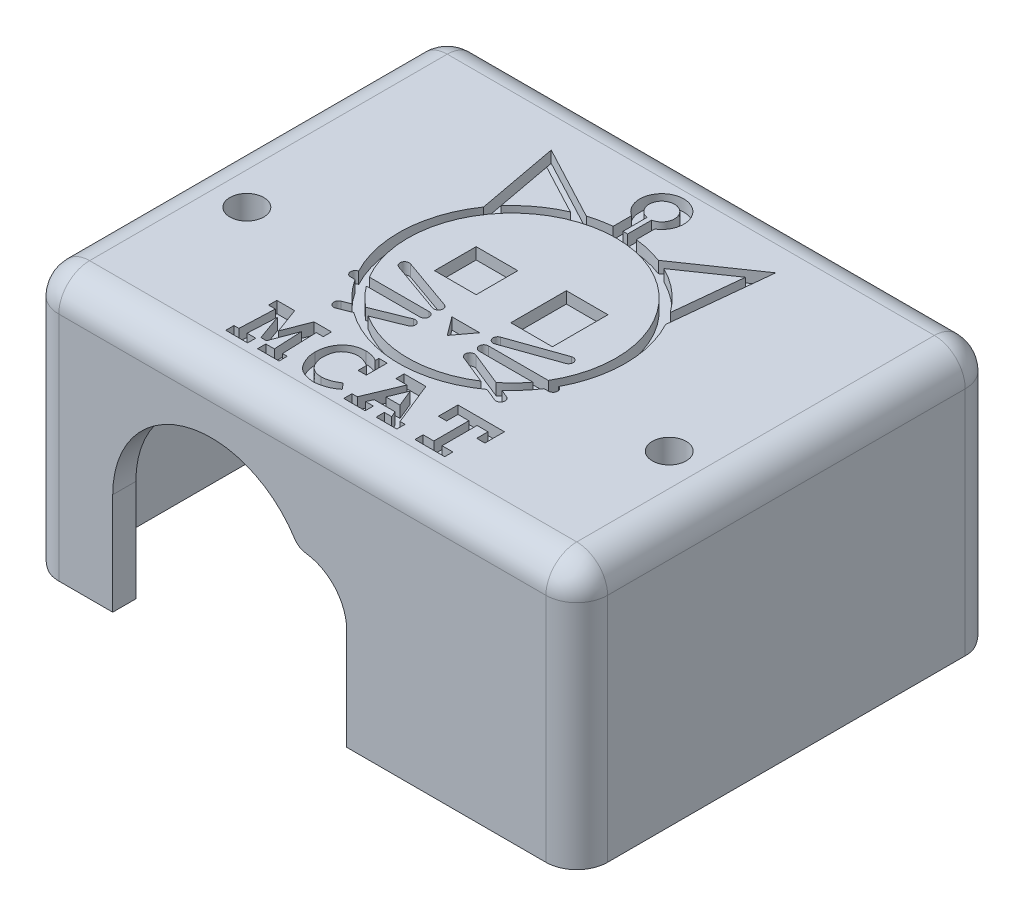
from build123d import *

# Parameters (mm, degrees)
SKETCH1_W           = 35.6
SKETCH1_H           = 27.2
BOSS_EXTRUDE1_DEPTH = 2
SKETCH3_W           = 35.6
SKETCH3_H           = 27.2
SKETCH3_W_2         = 32.6
SKETCH3_H_2         = 24.2
BOSS_EXTRUDE2_DEPTH = 15
CUT_EXTRUDE1_REACH  = 37.801
FILLET1_R           = 1
CUT_EXTRUDE2_REACH  = 42.955
SKETCH6_W           = 1.25
SKETCH6_H           = 8
FILLET2_R           = 1
CUT_EXTRUDE3_REACH  = 30.121
SKETCH7_R           = 1.1
FILLET4_R           = 2
FILLET5_R           = 1.5
SKETCH8_W           = 2.7
SKETCH8_H           = 3.6
SKETCH8_H_2         = 2.7
CUT_EXTRUDE4_DEPTH  = 0.75
CUT_EXTRUDE5_DEPTH  = 0.75


with BuildPart() as part:
    # Sketch1 → Boss-Extrude1 (new body)
    with BuildSketch(Plane(origin=(0, 0, 0), x_dir=(1, 0, 0), z_dir=(0, 1, 0))):
        Rectangle(SKETCH1_W, SKETCH1_H)
    extrude(amount=BOSS_EXTRUDE1_DEPTH)

    # Sketch3 → Boss-Extrude2 (add)
    with BuildSketch(Plane.XZ):
        Rectangle(SKETCH3_W, SKETCH3_H)
        Rectangle(SKETCH3_W_2, SKETCH3_H_2, mode=Mode.SUBTRACT)
    extrude(amount=BOSS_EXTRUDE2_DEPTH)

    # Sketch5 → Cut-Extrude1 (cut, up to next)
    with BuildSketch(Plane.XY.offset(13.6), mode=Mode.PRIVATE) as cut_extrude1_sk1:
        with BuildLine():
            Line((-12.3, -15), (-12.3, -8.4))
            ThreePointArc((-12.3, -8.4), (-7.44443562, -2.189145098), (-0.245400433, -5.402417018))
            ThreePointArc((-0.245400433, -5.402417018), (1.95331647, -6.236530414), (2.875, -8.4))
            Line((2.875, -8.4), (2.875, -15))
            Line((2.875, -15), (-12.3, -15))
        make_face()
    cut_extrude1_tool1 = extrude(cut_extrude1_sk1.sketch, amount=-CUT_EXTRUDE1_REACH, mode=Mode.PRIVATE) & part.part
    add(cut_extrude1_tool1.solids().sort_by_distance((-4.950325, -9.267969, 13.6))[0], mode=Mode.SUBTRACT)

    # Fillet1
    fillet1_edges = [part.edges().sort_by_distance(p)[0] for p in [
        (-0.245400433, -5.402417018, 12.85),
    ]]
    fillet(fillet1_edges, radius=FILLET1_R)

    # Sketch6 → Cut-Extrude2 (cut, up to next)
    with BuildSketch(Plane.ZY.offset(17.8), mode=Mode.PRIVATE) as cut_extrude2_sk1:
        with Locations((-7.975, -11)):
            Rectangle(SKETCH6_W, SKETCH6_H)
    cut_extrude2_tool1 = extrude(cut_extrude2_sk1.sketch, amount=-CUT_EXTRUDE2_REACH, mode=Mode.PRIVATE) & part.part
    add(cut_extrude2_tool1.solids().sort_by_distance((-17.8, -11, -7.975))[0], mode=Mode.SUBTRACT)

    # Fillet2
    fillet2_edges = [part.edges().sort_by_distance(p)[0] for p in [
        (16.3, -7.5, 12.1),
        (-16.3, -7.5, 12.1),
        (-16.3, -7.5, -12.1),
        (16.3, -7.5, -12.1),
    ]]
    fillet(fillet2_edges, radius=FILLET2_R)

    # Sketch7 → Cut-Extrude3 (cut, up to next)
    with BuildSketch(Plane(origin=(0, 2, 0), x_dir=(1, 0, 0), z_dir=(0, 1, 0)), mode=Mode.PRIVATE) as cut_extrude3_sk1:
        with Locations(Location((-13.7, -3.5, 0), (0, 0, 270))):
            Circle(SKETCH7_R)
    cut_extrude3_tool1 = extrude(cut_extrude3_sk1.sketch, amount=-CUT_EXTRUDE3_REACH, mode=Mode.PRIVATE) & part.part
    # Sketch7 → Cut-Extrude3 (cut, up to next)
    with BuildSketch(Plane(origin=(0, 2, 0), x_dir=(1, 0, 0), z_dir=(0, 1, 0)), mode=Mode.PRIVATE) as cut_extrude3_sk2:
        with Locations(Location((13.7, -3.5, 0), (0, 0, 270))):
            Circle(SKETCH7_R)
    cut_extrude3_tool2 = extrude(cut_extrude3_sk2.sketch, amount=-CUT_EXTRUDE3_REACH, mode=Mode.PRIVATE) & part.part
    add(cut_extrude3_tool1.solids().sort_by_distance((-13.7, 2, 3.5))[0], mode=Mode.SUBTRACT)
    add(cut_extrude3_tool2.solids().sort_by_distance((13.7, 2, 3.5))[0], mode=Mode.SUBTRACT)

    # Fillet4
    fillet4_edges = [part.edges().sort_by_distance(p)[0] for p in [
        (17.8, 2, 0),
        (0, 2, -13.6),
        (-17.8, 2, 0),
        (-17.8, -6.5, -13.6),
        (17.8, -6.5, -13.6),
        (17.8, -6.5, 13.6),
        (-17.8, -6.5, 13.6),
        (0, 2, 13.6),
    ]]
    fillet(fillet4_edges, radius=FILLET4_R)

    # Fillet5
    # the kernel refuses this fillet: 1.5 mm, written as the material it takes off along each edge
    with BuildSketch(Plane(origin=(-15.8, -15, -13.6), x_dir=(0, 0, 1), z_dir=(1, 0, 0))) as fillet5_piece_1:
        with BuildLine():
            CenterArc((FILLET5_R, -FILLET5_R), FILLET5_R, 90, 90)
            Line((0, -FILLET5_R), (0, 0))
            Line((0, 0), (FILLET5_R, 0))
        make_face()
    extrude(amount=35.35, mode=Mode.SUBTRACT)
    with BuildSketch(Plane(origin=(-17.8, -15, 15.35), x_dir=(0, 1, 0), z_dir=(0, 0, -1))) as fillet5_piece_2:
        with BuildLine():
            CenterArc((FILLET5_R, FILLET5_R), FILLET5_R, 180, 90)
            Line((0, FILLET5_R), (0, 0))
            Line((0, 0), (FILLET5_R, 0))
        make_face()
    extrude(amount=26.45, mode=Mode.SUBTRACT)
    with BuildSketch(Plane(origin=(-15.8, -15, -11.6), x_dir=(-1, 0, 0), z_dir=(0, 0, 1))) as fillet5_piece_3:
        with BuildLine():
            CenterArc((2 - FILLET5_R, -FILLET5_R), FILLET5_R, 0, 90)
            Line((2, -FILLET5_R), (2, 0))
            Line((2, 0), (2 - FILLET5_R, 0))
        make_face()
    revolve(axis=Axis((-15.8, -15, -11.6), (0, -1, 0)), revolution_arc=90, mode=Mode.SUBTRACT)
    with BuildSketch(Plane(origin=(-17.8, -15, -4.85), x_dir=(1, 0, 0), z_dir=(0, 0, -1))) as fillet5_piece_4:
        with BuildLine():
            CenterArc((FILLET5_R, -FILLET5_R), FILLET5_R, 90, 90)
            Line((0, -FILLET5_R), (0, 0))
            Line((0, 0), (FILLET5_R, 0))
        make_face()
    extrude(amount=6.75, mode=Mode.SUBTRACT)

    # Sketch8 → Cut-Extrude4 (cut)
    # profile 1 of 6: a face of its own
    with BuildSketch(Plane(origin=(0, 2, 0), x_dir=(1, 0, 0), z_dir=(0, 1, 0))):
        with BuildLine():
            Line((-0.75, 8.505629006), (-0.75, 7.336211556))
            Line((-0.75, 7.336211556), (-0.75, 7.311634564))
            ThreePointArc((-0.75, 7.311634564), (-1.48029755, 7.199390194), (-2.195635708, 7.014391195))
            Line((-2.195635708, 7.014391195), (-7.042682679, 9.587218689))
            Line((-7.042682679, 9.587218689), (-6.036927128, 4.192613845))
            ThreePointArc((-6.036927128, 4.192613845), (-7.337364656, 0.430789867), (-6.4860712, -3.457366105))
            ThreePointArc((-6.4860712, -3.457366105), (-6.718152787, -3.783240273), (-6.42, -4.05))
            Line((-6.42, -4.05), (-6.13351449, -4.05))
            ThreePointArc((-6.13351449, -4.05), (-5.54466624, -4.824849872), (-4.858607658, -5.515109393))
            Line((-4.858607658, -5.515109393), (-5.369789319, -5.721892557))
            ThreePointArc((-5.369789319, -5.721892557), (-5.535396762, -6.1125), (-5.144789319, -6.278107443))
            Line((-5.144789319, -6.278107443), (-4.321743388, -5.945168971))
            ThreePointArc((-4.321743388, -5.945168971), (0, -7.35), (4.321743388, -5.945168971))
            Line((4.321743388, -5.945168971), (5.144789319, -6.278107443))
            ThreePointArc((5.144789319, -6.278107443), (5.535396762, -6.1125), (5.369789319, -5.721892557))
            Line((5.369789319, -5.721892557), (4.858607658, -5.515109393))
            ThreePointArc((4.858607658, -5.515109393), (5.54466624, -4.824849872), (6.13351449, -4.05))
            Line((6.13351449, -4.05), (6.42, -4.05))
            ThreePointArc((6.42, -4.05), (6.718152787, -3.783240273), (6.4860712, -3.457366105))
            ThreePointArc((6.4860712, -3.457366105), (7.349970345, 0.020878865), (6.466324186, 3.49415963))
            Line((6.466324186, 3.49415963), (7.136935048, 9.970524713))
            Line((7.136935048, 9.970524713), (2.626797664, 6.864578212))
            ThreePointArc((2.626797664, 6.864578212), (1.703131076, 7.149954163), (0.75, 7.311634564))
            Line((0.75, 7.311634564), (0.75, 7.336211556))
            Line((0.75, 7.336211556), (0.75, 8.505629006))
            ThreePointArc((0.75, 8.505629006), (0, 11.142291088), (-0.75, 8.505629006))
        make_face()
        with BuildLine():
            Line((1.92, -4.05), (5.4, -4.05))
            ThreePointArc((5.4, -4.05), (4.852637538, -4.691951505), (4.229474624, -5.26061255))
            Line((4.229474624, -5.26061255), (2.0325, -4.371892557))
            ThreePointArc((2.0325, -4.371892557), (1.641892557, -4.5375), (1.8075, -4.928107443))
            Line((1.8075, -4.928107443), (3.654382536, -5.675208214))
            ThreePointArc((3.654382536, -5.675208214), (0, -6.75), (-3.654382536, -5.675208214))
            Line((-3.654382536, -5.675208214), (-1.8075, -4.928107443))
            ThreePointArc((-1.8075, -4.928107443), (-1.641892557, -4.5375), (-2.0325, -4.371892557))
            Line((-2.0325, -4.371892557), (-4.229474624, -5.26061255))
            ThreePointArc((-4.229474624, -5.26061255), (-4.852637538, -4.691951505), (-5.4, -4.05))
            Line((-5.4, -4.05), (-1.92, -4.05))
            ThreePointArc((-1.92, -4.05), (-1.62, -3.75), (-1.92, -3.45))
            Line((-1.92, -3.45), (-5.801723882, -3.45))
            ThreePointArc((-5.801723882, -3.45), (0, 6.75), (5.801723882, -3.45))
            Line((5.801723882, -3.45), (1.92, -3.45))
            ThreePointArc((1.92, -3.45), (1.62, -3.75), (1.92, -4.05))
        make_face(mode=Mode.SUBTRACT)
        with BuildLine():
            Line((-5.544497144, 4.825044188), (-6.224756479, 8.473774039))
            Line((-6.224756479, 8.473774039), (-2.946376415, 6.733599782))
            ThreePointArc((-2.946376415, 6.733599782), (-4.351365253, 5.923522637), (-5.544497144, 4.825044188))
        make_face(mode=Mode.SUBTRACT)
        with BuildLine():
            Line((6.406182278, 8.738772806), (5.948355978, 4.317355806))
            ThreePointArc((5.948355978, 4.317355806), (4.747551528, 5.610994073), (3.272959848, 6.581051119))
            Line((3.272959848, 6.581051119), (6.406182278, 8.738772806))
        make_face(mode=Mode.SUBTRACT)
        with BuildLine():
            Line((0.15, 8.906042051), (0.15, 7.348469228))
            ThreePointArc((0.15, 7.348469228), (0, 7.35), (-0.15, 7.348469228))
            Line((-0.15, 7.348469228), (-0.15, 8.906042051))
            ThreePointArc((-0.15, 8.906042051), (0, 10.542291088), (0.15, 8.906042051))
        make_face(mode=Mode.SUBTRACT)
    # profile 2 of 6: a face of its own
    with BuildSketch(Plane(origin=(0, 2, 0), x_dir=(1, 0, 0), z_dir=(0, 1, 0))):
        with Locations((2.7, 0.375)):
            Rectangle(SKETCH8_W, SKETCH8_H)
    # profile 3 of 6: a face of its own
    with BuildSketch(Plane(origin=(0, 2, 0), x_dir=(1, 0, 0), z_dir=(0, 1, 0))):
        with Locations((-2.7, 0.375)):
            Rectangle(SKETCH8_W, SKETCH8_H_2)
    # profile 4 of 6: a face of its own
    with BuildSketch(Plane(origin=(0, 2, 0), x_dir=(1, 0, 0), z_dir=(0, 1, 0))):
        with BuildLine():
            Line((-2.02, -3.132842712), (-5.41411255, -1.932842712))
            ThreePointArc((-5.41411255, -1.932842712), (-5.596955262, -1.55), (-5.21411255, -1.367157288))
            Line((-5.21411255, -1.367157288), (-1.82, -2.567157288))
            ThreePointArc((-1.82, -2.567157288), (-1.637157288, -2.95), (-2.02, -3.132842712))
        make_face()
    # profile 5 of 6: a face of its own
    with BuildSketch(Plane(origin=(0, 2, 0), x_dir=(1, 0, 0), z_dir=(0, 1, 0))):
        Polygon((-0.9, -3), (0, -4.2), (0.9, -3), align=None)
    # profile 6 of 6: a face of its own
    with BuildSketch(Plane(origin=(0, 2, 0), x_dir=(1, 0, 0), z_dir=(0, 1, 0))):
        with BuildLine():
            Line((2.02, -3.132842712), (5.41411255, -1.932842712))
            ThreePointArc((5.41411255, -1.932842712), (5.596955262, -1.55), (5.21411255, -1.367157288))
            Line((5.21411255, -1.367157288), (1.82, -2.567157288))
            ThreePointArc((1.82, -2.567157288), (1.637157288, -2.95), (2.02, -3.132842712))
        make_face()
    extrude(amount=-CUT_EXTRUDE4_DEPTH, mode=Mode.SUBTRACT)

    # Sketch9 → Cut-Extrude5 (cut)
    # profile 1 of 4: a face of its own
    with BuildSketch(Plane(origin=(0, 2, 0), x_dir=(1, 0, 0), z_dir=(0, 1, 0))):
        Polygon((-3.952746758, -8.290675394), (-3.952746758, -7.757813169), (-5.084215164, -7.757813169), (-5.727405409, -9.421344305), (-6.340818328, -7.757813169), (-7.496409126, -7.757813169), (-7.496409126, -8.290675394), (-7.060104811, -8.290675394), (-7.152566435, -10.563766057), (-7.473097758, -10.563766057), (-7.473097758, -11.096627459), (-6.054955997, -11.096627459), (-6.054955997, -10.563766057), (-6.618905536, -10.563766057), (-6.52543775, -8.685247814), (-5.923935762, -10.363547812), (-5.566607848, -10.363547812), (-4.941283999, -8.70291413), (-4.853448915, -10.563766057), (-5.405810287, -10.563766057), (-5.405810287, -11.096627459), (-4.016853023, -11.096627459), (-4.016853023, -10.563766057), (-4.325728661, -10.563766057), (-4.406519779, -8.290675394), align=None)
    # profile 2 of 4: a face of its own
    with BuildSketch(Plane(origin=(0, 2, 0), x_dir=(1, 0, 0), z_dir=(0, 1, 0))):
        with BuildLine():
            Line((-0.377104537, -10.635134482), (-0.701577352, -10.241860523))
            add(Edge.make_bspline(
                [(-0.701577352, -10.241860523), (-0.728553289, -10.260751278), (-0.786498845, -10.301329492), (-0.885593618, -10.357823102), (-1.000170317, -10.418876148), (-1.13049196, -10.480223599), (-1.273062146, -10.53862052), (-1.428281811, -10.580071503), (-1.591971046, -10.608700229), (-1.704698377, -10.614679324), (-1.762152421, -10.617726706)],
                knots=[0, 0, 0, 0, 0.69197359, 1.486391206, 2.395551588, 3.420998499, 4.51373008, 5.628848512, 6.791488796, 8, 8, 8, 8], degree=3))
            add(Edge.make_bspline(
                [(-1.762152421, -10.617726706), (-1.80748155, -10.61517626), (-1.895184415, -10.610241655), (-2.021607072, -10.58960633), (-2.138582086, -10.559907056), (-2.245946707, -10.518380833), (-2.343484239, -10.465720465), (-2.432155852, -10.403228714), (-2.510334707, -10.329241018), (-2.577240773, -10.245046408), (-2.636029515, -10.154997919), (-2.686783865, -10.060058965), (-2.729475924, -9.961505187), (-2.765509939, -9.859722712), (-2.79249916, -9.753891497), (-2.810552817, -9.644135458), (-2.822198872, -9.53089948), (-2.822608861, -9.45422951), (-2.822816414, -9.415416011)],
                knots=[0, 0, 0, 0, 1.203924323, 2.329354575, 3.39287491, 4.401019398, 5.375278256, 6.32710417, 7.271334008, 8.220497958, 9.173987471, 10.121480228, 11.073247717, 12.021327193, 12.983525084, 13.966732579, 14.970676216, 16, 16, 16, 16], degree=3))
            add(Edge.make_bspline(
                [(-2.822816414, -9.415416011), (-2.819607438, -9.362798505), (-2.813424199, -9.26141208), (-2.792742447, -9.115430479), (-2.760615015, -8.981763106), (-2.719397433, -8.859736152), (-2.66946695, -8.748836587), (-2.607002463, -8.651383389), (-2.536299653, -8.564766251), (-2.454386273, -8.492925506), (-2.36866968, -8.431770816), (-2.283377433, -8.377188819), (-2.198216636, -8.331216483), (-2.112803759, -8.295080753), (-2.028009819, -8.266725285), (-1.943318346, -8.247411881), (-1.858612414, -8.235558449), (-1.802097971, -8.235766409), (-1.773956313, -8.235869964)],
                knots=[0, 0, 0, 0, 1.432669308, 2.760549281, 4.002082665, 5.164184454, 6.258059152, 7.298720495, 8.302349713, 9.287044429, 10.249799678, 11.163309256, 12.038308959, 12.87696556, 13.681485547, 14.465428047, 15.235851988, 16, 16, 16, 16], degree=3))
            add(Edge.make_bspline(
                [(-1.773956313, -8.235869964), (-1.736257893, -8.237266021), (-1.661167994, -8.240046769), (-1.549069029, -8.254436167), (-1.438958639, -8.279147018), (-1.330602772, -8.312281066), (-1.225297275, -8.352750272), (-1.122541678, -8.398555492), (-1.023248384, -8.449483922), (-0.959826774, -8.488139061), (-0.928291778, -8.507359476)],
                knots=[0, 0, 0, 0, 1.006249972, 2.004307052, 3.01047319, 4.013924909, 5.02505319, 6.018705561, 7.014845034, 8, 8, 8, 8], degree=3))
            Line((-0.928291778, -8.507359476), (-0.927450289, -9.056436409))
            Line((-0.927450289, -9.056436409), (-0.394588064, -9.056436409))
            Line((-0.394588064, -9.056436409), (-0.394588064, -7.7051164))
            Line((-0.394588064, -7.7051164), (-0.927450289, -7.7051164))
            Line((-0.927450289, -7.7051164), (-0.927450289, -7.949885774))
            add(Edge.make_bspline(
                [(-0.927450289, -7.949885774), (-0.940486961, -7.940125509), (-0.971482874, -7.916919562), (-1.030954452, -7.88391113), (-1.109260547, -7.845632534), (-1.206164166, -7.802324921), (-1.322643468, -7.76108886), (-1.45938848, -7.733412361), (-1.613462252, -7.712657271), (-1.722447215, -7.707994317), (-1.779858259, -7.705537968)],
                knots=[0, 0, 0, 0, 0.433725753, 1.031223725, 1.808509562, 2.75781494, 3.859485631, 5.093802487, 6.469074763, 8, 8, 8, 8], degree=3))
            add(Edge.make_bspline(
                [(-1.779858259, -7.705537968), (-1.836992821, -7.708189803), (-1.948667194, -7.713373041), (-2.11201648, -7.737956638), (-2.266398218, -7.777650318), (-2.412845875, -7.831020149), (-2.550946257, -7.898594859), (-2.680354667, -7.981039851), (-2.802124842, -8.076782356), (-2.91331712, -8.187160226), (-3.014540142, -8.308439884), (-3.103699027, -8.439544627), (-3.17830622, -8.580164946), (-3.241806251, -8.728778429), (-3.289844554, -8.886719471), (-3.326515551, -9.052965956), (-3.349319283, -9.228203653), (-3.354084776, -9.348180506), (-3.356520951, -9.409514065)],
                knots=[0, 0, 0, 0, 1.05741639, 2.066810492, 3.048972731, 4.001170081, 4.945044416, 5.886754771, 6.83418673, 7.804613306, 8.779013696, 9.752220869, 10.731338192, 11.719028759, 12.736794188, 13.779892258, 14.865055158, 16, 16, 16, 16], degree=3))
            add(Edge.make_bspline(
                [(-3.356520951, -9.409514065), (-3.356854401, -9.455080397), (-3.357527199, -9.547019243), (-3.342027365, -9.685165815), (-3.316511026, -9.824280257), (-3.280775555, -9.964459634), (-3.230647618, -10.104785325), (-3.171130846, -10.246753718), (-3.098676549, -10.389211647), (-3.017244215, -10.531648983), (-2.920814077, -10.667537041), (-2.803697057, -10.786958561), (-2.670456663, -10.891314497), (-2.517922161, -10.976142046), (-2.349625123, -11.046728093), (-2.163057045, -11.098014213), (-1.960117439, -11.134658995), (-1.81851465, -11.145158603), (-1.745289719, -11.150588108)],
                knots=[0, 0, 0, 0, 0.821596056, 1.657728174, 2.503204378, 3.372806978, 4.264530001, 5.189449641, 6.148776969, 7.146411173, 8.148610527, 9.145587176, 10.153888004, 11.191749732, 12.285177277, 13.43941716, 14.675884115, 16, 16, 16, 16], degree=3))
            add(Edge.make_bspline(
                [(-1.745289719, -11.150588108), (-1.728140996, -11.150833531), (-1.691263275, -11.151361304), (-1.632666886, -11.146781201), (-1.567320654, -11.137596093), (-1.495144737, -11.127309066), (-1.416212741, -11.111580825), (-1.330797149, -11.092265807), (-1.238438129, -11.069018866), (-1.10589011, -11.035290543), (-0.937830287, -10.978776748), (-0.742625362, -10.886732972), (-0.553443681, -10.773703696), (-0.436923435, -10.6820154), (-0.377104537, -10.635134482)],
                knots=[0, 0, 0, 0, 0.415001924, 0.892446971, 1.42070112, 2.012432692, 2.656882515, 3.368243347, 4.13221601, 4.96224774, 6.679082992, 8.413927101, 10.178071488, 12, 12, 12, 12], degree=3))
        make_face()
    # profile 3 of 4: a face of its own
    with BuildSketch(Plane(origin=(0, 2, 0), x_dir=(1, 0, 0), z_dir=(0, 1, 0))):
        Polygon((3.625480234, -11.096627459), (3.625480234, -10.563766057), (3.302932468, -10.563766057), (2.171280449, -7.757813169), (0.76030369, -7.757813169), (0.76030369, -8.290675394), (1.477128285, -8.290675394), (0.527190001, -10.563766057), (0.183347309, -10.563766057), (0.183347309, -11.096627459), (1.570373761, -11.096627459), (1.570373761, -10.563766057), (1.069179329, -10.563766057), (1.238186753, -10.179297262), (2.59431115, -10.179297262), (2.761384469, -10.563766057), (2.283209108, -10.563766057), (2.283209108, -11.096627459), align=None)
        Polygon((2.38114864, -9.646435036), (1.465472601, -9.646435036), (1.923848283, -8.531726411), align=None, mode=Mode.SUBTRACT)
    # profile 4 of 4: a face of its own
    with BuildSketch(Plane(origin=(0, 2, 0), x_dir=(1, 0, 0), z_dir=(0, 1, 0))):
        Polygon((7.267823995, -9.026796586), (7.267823995, -7.757813169), (4.252772771, -7.757813169), (4.252772771, -9.026796586), (4.785634996, -9.026796586), (4.785634996, -8.290675394), (5.493867682, -8.290675394), (5.493867682, -10.563766057), (4.797244572, -10.563766057), (4.797244572, -11.096627459), (6.729109226, -11.096627459), (6.729109226, -10.563766057), (6.026729907, -10.563766057), (6.026729907, -8.290675394), (6.73496177, -8.290675394), (6.73496177, -9.026796586), align=None)
    extrude(amount=-CUT_EXTRUDE5_DEPTH, mode=Mode.SUBTRACT)


solid = part.part
